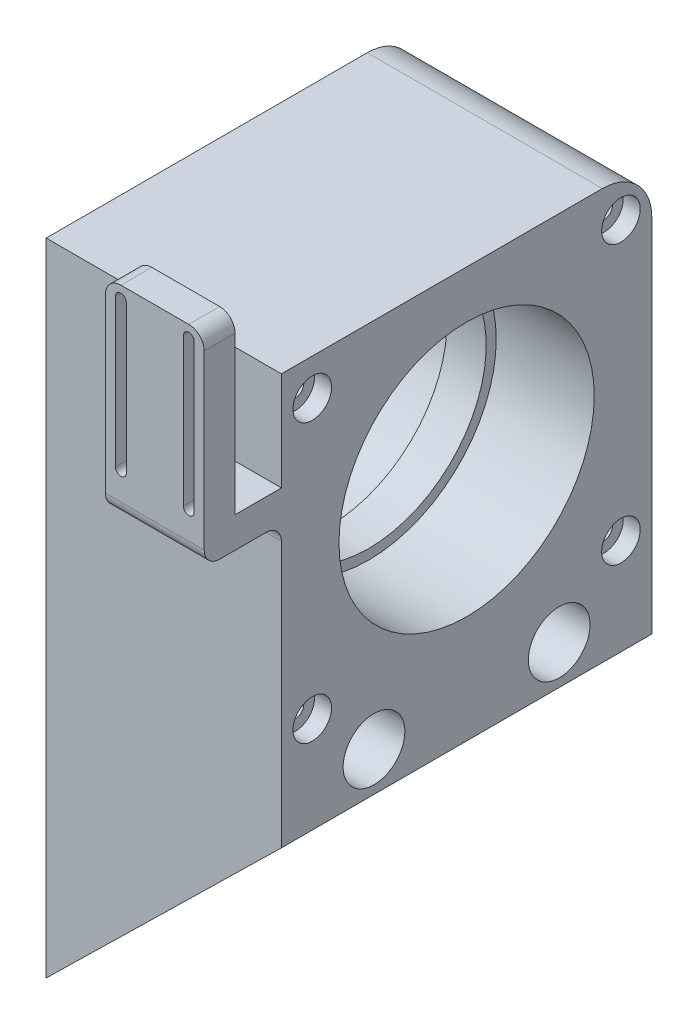
from build123d import *

# Parameters (mm, degrees)
BOSS_EXTRUDE1_DEPTH = 120
SKETCH3_R           = 4.25
CUT_EXTRUDE1_DEPTH  = 120
SKETCH5_R           = 10
CUT_EXTRUDE2_DEPTH  = 53
SKETCH6_R           = 4.25
CUT_EXTRUDE3_DEPTH  = 103
SKETCH7_W           = 76.2
SKETCH7_H           = 120
BOSS_EXTRUDE2_DEPTH = 101.6
SKETCH8_R           = 41.35
CUT_EXTRUDE4_DEPTH  = 31.75
CUT_EXTRUDE5_START  = -31.75
SKETCH9_R           = 41.35
CUT_EXTRUDE5_DEPTH  = 31.75
SKETCH10_R          = 38.1
CUT_EXTRUDE6_DEPTH  = 76.2
SKETCH13_W          = 76.2
SKETCH13_H          = 120
BOSS_EXTRUDE3_DEPTH = 6
SKETCH11_R          = 2.75
CUT_EXTRUDE7_DEPTH  = 84.4
SKETCH12_R          = 6.25
CUT_EXTRUDE8_DEPTH  = 5.5
FILLET1_R           = 16
SKETCH18_W          = 32
SKETCH18_H          = 10
BOSS_EXTRUDE6_DEPTH = 15
SKETCH20_W          = 32
SKETCH20_H          = 65.882542047
BOSS_EXTRUDE7_DEPTH = 10
FILLET3_R           = 5


with BuildPart() as part:
    # Sketch1 → Boss-Extrude1 (new body)
    with BuildSketch(Plane.XY):
        Polygon((381, 457.2), (457.2, 457.2), (457.2, 431.8), (381, 357.2), align=None)
    extrude(amount=BOSS_EXTRUDE1_DEPTH)

    # Sketch3 → Cut-Extrude1 (cut)
    with BuildSketch(Plane(origin=(457.2, 0, 0), x_dir=(0, 0, -1), z_dir=(1, 0, 0))):
        with Locations((-90, 394.5)):
            Circle(SKETCH3_R)
        with Locations((-30, 394.5)):
            Circle(SKETCH3_R)
    extrude(amount=-CUT_EXTRUDE1_DEPTH, mode=Mode.SUBTRACT)

    # Sketch5 → Cut-Extrude2 (cut)
    with BuildSketch(Plane(origin=(457.2, 0, 0), x_dir=(0, 0, -1), z_dir=(1, 0, 0))):
        with Locations((-90, 394.5)):
            Circle(SKETCH5_R)
        with Locations((-30, 394.5)):
            Circle(SKETCH5_R)
        with Locations((-90, 444.5)):
            Circle(SKETCH5_R)
        with Locations((-30, 444.5)):
            Circle(SKETCH5_R)
    extrude(amount=-CUT_EXTRUDE2_DEPTH, mode=Mode.SUBTRACT)

    # Sketch6 → Cut-Extrude3 (cut)
    with BuildSketch(Plane(origin=(457.2, 0, 0), x_dir=(0, 0, -1), z_dir=(1, 0, 0))):
        with Locations((-90, 444.5)):
            Circle(SKETCH6_R)
        with Locations((-30, 444.5)):
            Circle(SKETCH6_R)
    extrude(amount=-CUT_EXTRUDE3_DEPTH, mode=Mode.SUBTRACT)

    # Sketch7 → Boss-Extrude2 (add)
    with BuildSketch(Plane(origin=(0, 457.2, 0), x_dir=(1, 0, 0), z_dir=(0, 1, 0))):
        with Locations((419.1, -60)):
            Rectangle(SKETCH7_W, SKETCH7_H)
    extrude(amount=BOSS_EXTRUDE2_DEPTH)

    # Sketch8 → Cut-Extrude4 (cut)
    with BuildSketch(Plane.ZY.offset(-381)):
        with Locations((60, 508)):
            Circle(SKETCH8_R)
    extrude(amount=-CUT_EXTRUDE4_DEPTH, mode=Mode.SUBTRACT)

    # Sketch9 → Cut-Extrude5 (cut)
    with BuildSketch(Plane(origin=(457.2, 0, 0), x_dir=(0, 0, -1), z_dir=(1, 0, 0)).offset(CUT_EXTRUDE5_START)):
        with Locations((-60, 508)):
            Circle(SKETCH9_R)
    extrude(amount=CUT_EXTRUDE5_DEPTH, mode=Mode.SUBTRACT)

    # Sketch10 → Cut-Extrude6 (cut)
    with BuildSketch(Plane(origin=(457.2, 0, 0), x_dir=(0, 0, -1), z_dir=(1, 0, 0))):
        with Locations((-60, 508)):
            Circle(SKETCH10_R)
    extrude(amount=-CUT_EXTRUDE6_DEPTH, mode=Mode.SUBTRACT)

    # Sketch13 → Boss-Extrude3 (add)
    with BuildSketch(Plane(origin=(0, 558.8, 0), x_dir=(1, 0, 0), z_dir=(0, 1, 0))):
        with Locations((419.1, -60)):
            Rectangle(SKETCH13_W, SKETCH13_H)
    extrude(amount=BOSS_EXTRUDE3_DEPTH)

    # Sketch11 → Cut-Extrude7 (cut)
    with BuildSketch(Plane(origin=(457.2, 0, 0), x_dir=(0, 0, -1), z_dir=(1, 0, 0))):
        with Locations((-110, 553)):
            Circle(SKETCH11_R)
        with Locations((-10, 553)):
            Circle(SKETCH11_R)
        with Locations((-110, 463)):
            Circle(SKETCH11_R)
        with Locations((-10, 463)):
            Circle(SKETCH11_R)
    extrude(amount=-CUT_EXTRUDE7_DEPTH, mode=Mode.SUBTRACT)

    # Sketch12 → Cut-Extrude8 (cut)
    with BuildSketch(Plane(origin=(457.2, 0, 0), x_dir=(0, 0, -1), z_dir=(1, 0, 0))):
        with Locations((-110, 553)):
            Circle(SKETCH12_R)
        with Locations((-10, 553)):
            Circle(SKETCH12_R)
        with Locations((-10, 463)):
            Circle(SKETCH12_R)
        with Locations((-110, 463)):
            Circle(SKETCH12_R)
    extrude(amount=-CUT_EXTRUDE8_DEPTH, mode=Mode.SUBTRACT)

    # Fillet1
    fillet1_edges = [part.edges().sort_by_distance(p)[0] for p in [
        (419.1, 564.8, 0),
    ]]
    fillet(fillet1_edges, radius=FILLET1_R)

    # Sketch18 → Boss-Extrude6 (add)
    with BuildSketch(Plane.XY.offset(120)):
        with Locations((441.2, 527.8)):
            Rectangle(SKETCH18_W, SKETCH18_H)
    extrude(amount=BOSS_EXTRUDE6_DEPTH)

    # Sketch20 → Boss-Extrude7 (add)
    with BuildSketch(Plane.XY.offset(135)):
        with Locations((441.2, 555.741271024)):
            Rectangle(SKETCH20_W, SKETCH20_H)
        with BuildLine():
            ThreePointArc((450.45, 584.682542047), (452.2, 586.432542047), (453.95, 584.682542047))
            Line((453.95, 584.682542047), (453.95, 536.8))
            ThreePointArc((453.95, 536.8), (452.2, 535.05), (450.45, 536.8))
            Line((450.45, 536.8), (450.45, 584.682542047))
        make_face(mode=Mode.SUBTRACT)
        with BuildLine():
            ThreePointArc((428.45, 584.682542047), (430.2, 586.432542047), (431.95, 584.682542047))
            Line((431.95, 584.682542047), (431.95, 536.8))
            ThreePointArc((431.95, 536.8), (430.2, 535.05), (428.45, 536.8))
            Line((428.45, 536.8), (428.45, 584.682542047))
        make_face(mode=Mode.SUBTRACT)
    extrude(amount=BOSS_EXTRUDE7_DEPTH)

    # Fillet3
    fillet3_edges = [part.edges().sort_by_distance(p)[0] for p in [
        (441.2, 522.8, 145),
        (425.2, 588.682542047, 140),
        (457.2, 588.682542047, 140),
        (441.2, 522.8, 120),
    ]]
    fillet(fillet3_edges, radius=FILLET3_R)


solid = part.part
